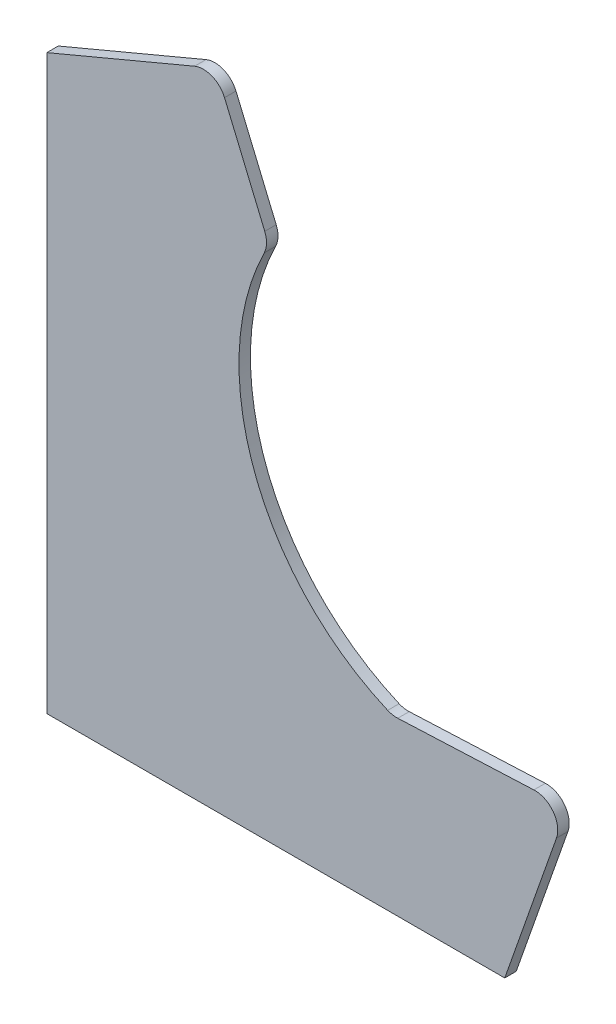
from build123d import *

# Parameters (mm, degrees)
BOSS_EXTRU_1_DEPTH = 10


with BuildPart() as part:
    # Esquisse1 → Boss.-Extru.1 (new body)
    with BuildSketch(Plane.XY):
        with BuildLine():
            Line((0, 0), (0, 500))
            Line((0, 500), (129.062590026, 554.250037842))
            ThreePointArc((129.062590026, 554.250037842), (144.369719008, 554.329896284), (155.249962158, 543.562590026))
            Line((155.249962158, 543.562590026), (190.372911185, 460.003961295))
            ThreePointArc((190.372911185, 460.003961295), (191.926850898, 451.665834452), (189.885391956, 443.433487687))
            ThreePointArc((189.885391956, 443.433487687), (181.169484506, 274.26267184), (297.753339321, 151.368665586))
            ThreePointArc((297.753339321, 151.368665586), (302.056817542, 150.06646388), (306.542440257, 149.758498089))
            Line((306.542440257, 149.758498089), (425.426774363, 155.003982264))
            ThreePointArc((425.426774363, 155.003982264), (442.370846485, 146.939662757), (445.174523614, 128.385034663))
            Line((445.174523614, 128.385034663), (400, 0))
            Line((400, 0), (0, 0))
        make_face()
    extrude(amount=BOSS_EXTRU_1_DEPTH)


solid = part.part
